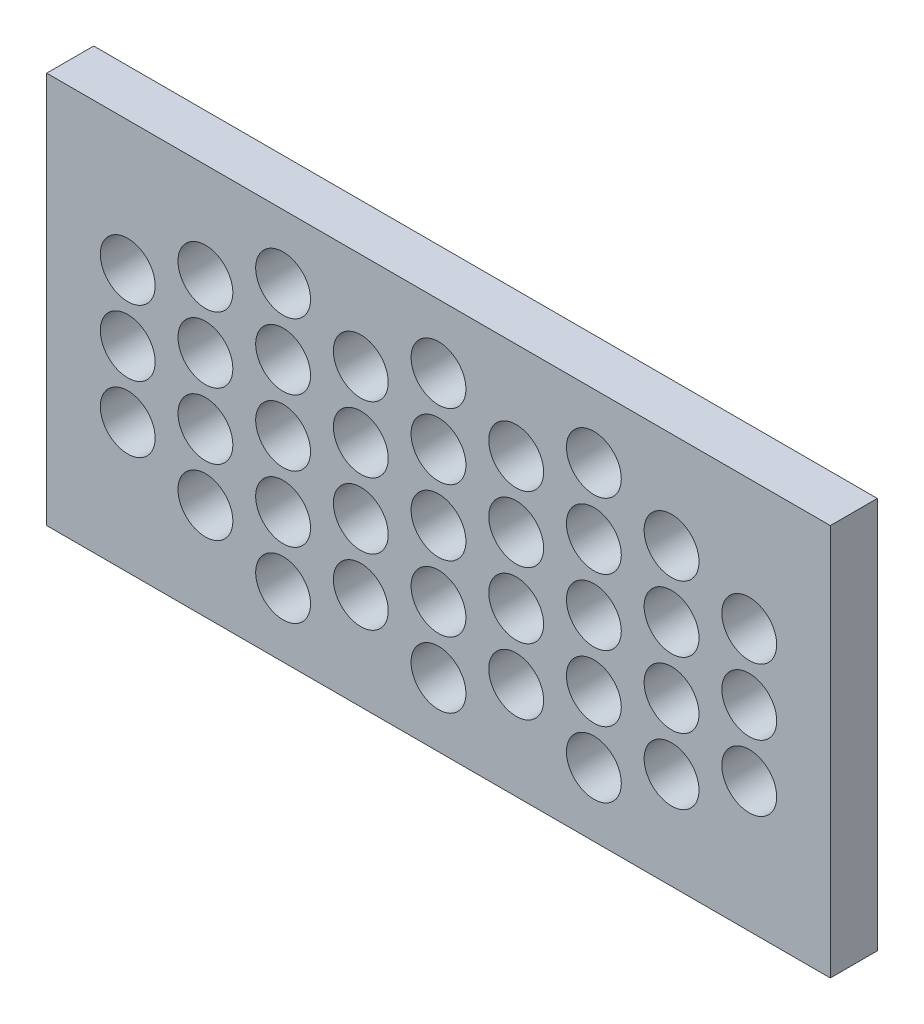
from build123d import *

# Parameters (mm, degrees)
SKETCH1_W               = 200
SKETCH1_H               = 100
BOSS_EXTRUDE1_DEPTH     = 12
CUT_EXTRUDE1_REACH      = 114.446
SKETCH2_R               = 7
FILL_PATTERN1_OUTLINE_R = 7
FILL_PATTERN1_DEPTH     = 12


# Read off the part's stored shape, not the designer's step: Fill Pattern1
with BuildPart() as part:
    # Sketch1 → Boss-Extrude1 (new body)
    with BuildSketch(Plane.XY):
        Rectangle(SKETCH1_W, SKETCH1_H)
    extrude(amount=BOSS_EXTRUDE1_DEPTH)

    # Sketch2 → Cut-Extrude1 (cut, up to next)
    with BuildSketch(Plane.XY.offset(12), mode=Mode.PRIVATE) as cut_extrude1_sk1:
        Circle(SKETCH2_R)
    cut_extrude1_tool1 = extrude(cut_extrude1_sk1.sketch, amount=-CUT_EXTRUDE1_REACH, mode=Mode.PRIVATE) & part.part
    add(cut_extrude1_tool1.solids().sort_by_distance((0, 0, 12))[0], mode=Mode.SUBTRACT)

    # Fill Pattern1 outline → Fill Pattern1 (cut)
    with BuildSketch(Plane.XY):
        with Locations((-39.656562733, 33.666424355)):
            Circle(FILL_PATTERN1_OUTLINE_R)
        with Locations((39.656562733, -33.666424355)):
            Circle(FILL_PATTERN1_OUTLINE_R)
        with Locations((59.484844099, -25.249818266)):
            Circle(FILL_PATTERN1_OUTLINE_R)
        with Locations((79.313125466, -16.833212178)):
            Circle(FILL_PATTERN1_OUTLINE_R)
        with Locations((19.828281366, 25.249818266)):
            Circle(FILL_PATTERN1_OUTLINE_R)
        with Locations((0, 16.833212178)):
            Circle(FILL_PATTERN1_OUTLINE_R)
        with Locations((-19.828281366, 8.416606089)):
            Circle(FILL_PATTERN1_OUTLINE_R)
        with Locations((-39.656562733, 0)):
            Circle(FILL_PATTERN1_OUTLINE_R)
        with Locations((-59.484844099, -8.416606089)):
            Circle(FILL_PATTERN1_OUTLINE_R)
        with Locations((-79.313125466, -16.833212178)):
            Circle(FILL_PATTERN1_OUTLINE_R)
        with Locations((59.484844099, 25.249818266)):
            Circle(FILL_PATTERN1_OUTLINE_R)
        with Locations((39.656562733, 16.833212178)):
            Circle(FILL_PATTERN1_OUTLINE_R)
        with Locations((-59.484844099, 25.249818266)):
            Circle(FILL_PATTERN1_OUTLINE_R)
        with Locations((-79.313125466, 16.833212178)):
            Circle(FILL_PATTERN1_OUTLINE_R)
        with Locations((0, 33.666424355)):
            Circle(FILL_PATTERN1_OUTLINE_R)
        with Locations((-19.828281366, 25.249818266)):
            Circle(FILL_PATTERN1_OUTLINE_R)
        with Locations((39.656562733, 33.666424355)):
            Circle(FILL_PATTERN1_OUTLINE_R)
        with Locations((-79.313125466, 0)):
            Circle(FILL_PATTERN1_OUTLINE_R)
        with Locations((-59.484844099, 8.416606089)):
            Circle(FILL_PATTERN1_OUTLINE_R)
        with Locations((-39.656562733, 16.833212178)):
            Circle(FILL_PATTERN1_OUTLINE_R)
        with Locations((79.313125466, 0)):
            Circle(FILL_PATTERN1_OUTLINE_R)
        with Locations((-39.656562733, -33.666424355)):
            Circle(FILL_PATTERN1_OUTLINE_R)
        with Locations((-19.828281366, -25.249818266)):
            Circle(FILL_PATTERN1_OUTLINE_R)
        with Locations((0, -16.833212178)):
            Circle(FILL_PATTERN1_OUTLINE_R)
        with Locations((59.484844099, -8.416606089)):
            Circle(FILL_PATTERN1_OUTLINE_R)
        with Locations((39.656562733, -16.833212178)):
            Circle(FILL_PATTERN1_OUTLINE_R)
        with Locations((19.828281366, -25.249818266)):
            Circle(FILL_PATTERN1_OUTLINE_R)
        with Locations((0, -33.666424355)):
            Circle(FILL_PATTERN1_OUTLINE_R)
        with Locations((19.828281366, 8.416606089)):
            Circle(FILL_PATTERN1_OUTLINE_R)
        with Locations((-19.828281366, -8.416606089)):
            Circle(FILL_PATTERN1_OUTLINE_R)
        with Locations((-39.656562733, -16.833212178)):
            Circle(FILL_PATTERN1_OUTLINE_R)
        with Locations((-59.484844099, -25.249818266)):
            Circle(FILL_PATTERN1_OUTLINE_R)
        with Locations((79.313125466, 16.833212178)):
            Circle(FILL_PATTERN1_OUTLINE_R)
        with Locations((59.484844099, 8.416606089)):
            Circle(FILL_PATTERN1_OUTLINE_R)
        with Locations((39.656562733, 0)):
            Circle(FILL_PATTERN1_OUTLINE_R)
        with Locations((19.828281366, -8.416606089)):
            Circle(FILL_PATTERN1_OUTLINE_R)
    extrude(amount=FILL_PATTERN1_DEPTH, mode=Mode.SUBTRACT)


solid = part.part
